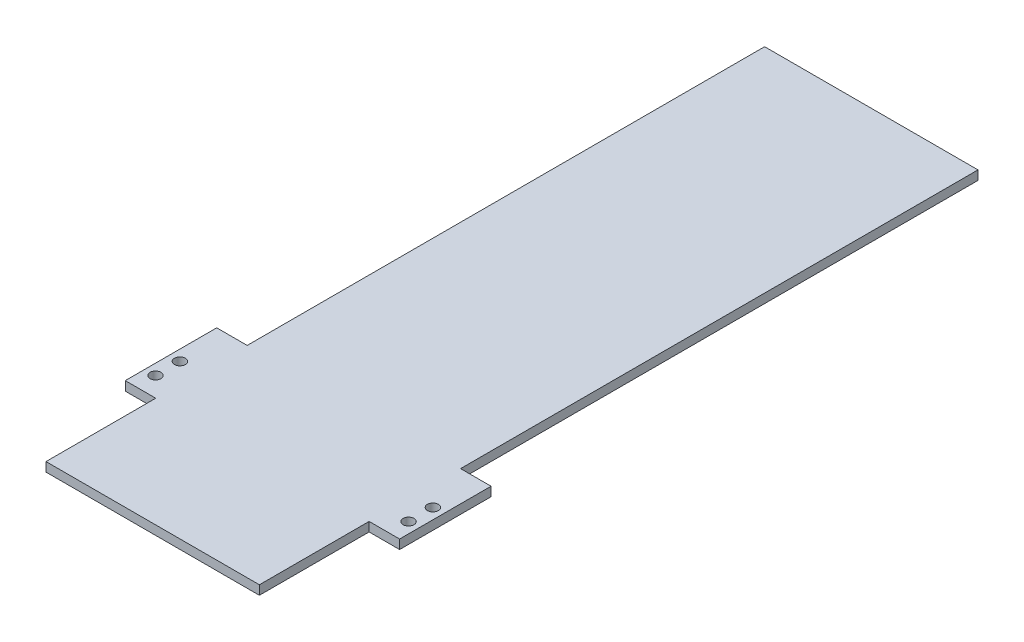
from build123d import *

# Parameters (mm, degrees)
BOSS_EXTRUDE5_DEPTH  = 3
M3_CLEARANCE_HOLE1_D = 3.6


with BuildPart() as part:
    # Sketch5 → Boss-Extrude5 (new body)
    with BuildSketch(Plane(origin=(0, 0, 0), x_dir=(1, 0, 0), z_dir=(0, 1, 0))):
        Polygon((80, 66), (70, 66), (70, 235.74), (0, 235.74), (0, 66), (-10, 66), (-10, 36), (0, 36), (0, 0), (70, 0), (70, 36), (80, 36), align=None)
    extrude(amount=BOSS_EXTRUDE5_DEPTH)

    # M3 Clearance Hole1 (through all)
    with Locations(Plane(origin=(0, 3, 0), x_dir=(1, 0, 0), z_dir=(0, 1, 0))):
        with Locations((76.5, 50.420635549), (76.5, 42.420635549)):
            m3_clearance_hole1 = Hole(M3_CLEARANCE_HOLE1_D / 2)

    # Mirror1: M3 Clearance Hole1 across plane
    add(m3_clearance_hole1.mirror(Plane.ZY.offset(-35)), mode=Mode.SUBTRACT)


solid = part.part
